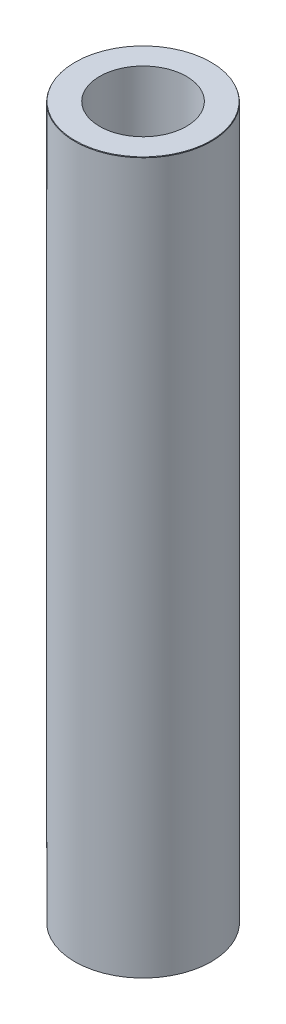
from build123d import *
from OCP.BRepFilletAPI import BRepFilletAPI_MakeChamfer

# Parameters (mm, degrees)
SKETCH1_R           = 47.5
BOSS_EXTRUDE1_DEPTH = 495.366377589
SKETCH2_R           = 30.217136617
CUT_EXTRUDE1_DEPTH  = 500.900338113
CHAMFER1_SIZE       = 0.460905135
CHAMFER1_SIZE2      = 0.17843249


with BuildPart() as part:
    # Sketch1 → Boss-Extrude1 (new body)
    with BuildSketch(Plane(origin=(0, 0, 0), x_dir=(1, 0, 0), z_dir=(0, 1, 0))):
        Circle(SKETCH1_R)
    extrude(amount=BOSS_EXTRUDE1_DEPTH)

    # Sketch2 → Cut-Extrude1 (cut, through all)
    with BuildSketch(Plane(origin=(0, 0, 0), x_dir=(1, 0, 0), z_dir=(0, 1, 0))):
        Circle(SKETCH2_R)
    extrude(amount=CUT_EXTRUDE1_DEPTH, mode=Mode.SUBTRACT)

    # Chamfer1: one chamfer whose edges measure the first distance from different faces: ONE call of the kernel's chamfer builder (chamfer() names one face for all edges)
    chamfer1_edges_1 = [part.edges().sort_by_distance(p)[0] for p in [
        (-47.5, 495.366377589, 0),
    ]]
    chamfer1_side_1 = [part.faces().sort_by_distance(p)[0] for p in [
        (-47.5, 247.683188794, 0),
    ]]
    chamfer1_edges_2 = [part.edges().sort_by_distance(p)[0] for p in [
        (-47.5, 0, 0),
    ]]
    chamfer1_side_2 = [part.faces().sort_by_distance(p)[0] for p in [
        (-46.156497116, 0, 0),
    ]]
    chamfer1 = BRepFilletAPI_MakeChamfer(part.part.solid().wrapped)
    for e in chamfer1_edges_1:
        chamfer1.Add(CHAMFER1_SIZE, CHAMFER1_SIZE2, e.wrapped, chamfer1_side_1[0].wrapped)  # the first distance lies on this face
    for e in chamfer1_edges_2:
        chamfer1.Add(CHAMFER1_SIZE, CHAMFER1_SIZE2, e.wrapped, chamfer1_side_2[0].wrapped)  # the first distance lies on this face
    add(Compound.cast(chamfer1.Shape()), mode=Mode.REPLACE)


solid = part.part
